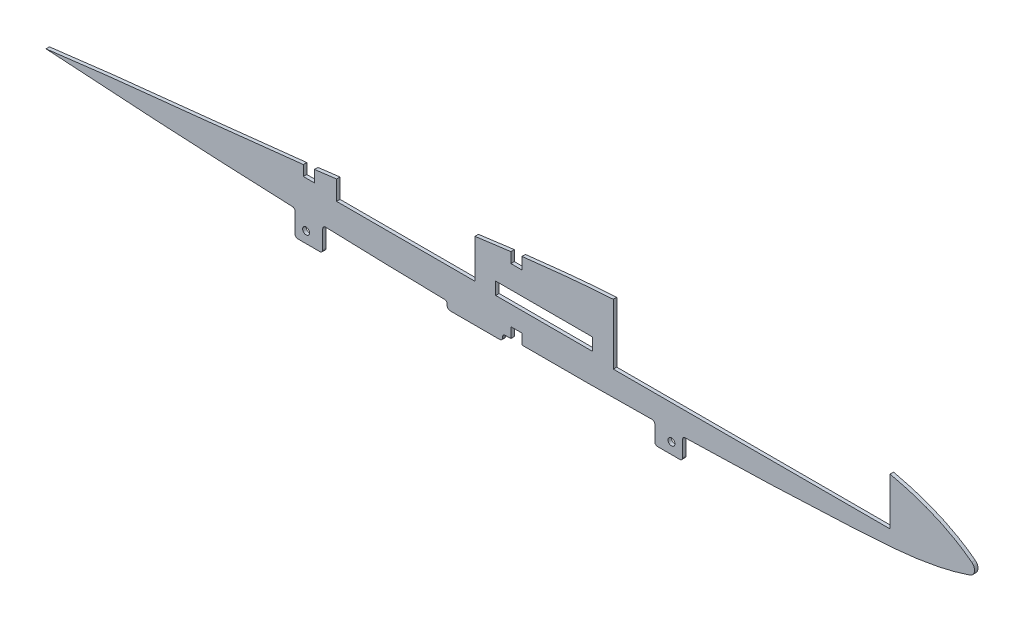
from build123d import *

# Parameters (mm, degrees)
BOSS_EXTRUDE1_DEPTH = 3.175
FILLET1_R           = 6.35
SKETCH6_W           = 88.9
SKETCH6_H           = 11.43
CUT_EXTRUDE3_DEPTH  = 5.08
SKETCH3_W           = 25.4
SKETCH3_H           = 3.175
BOSS_EXTRUDE2_DEPTH = 31.75
SKETCH3_3_W         = 50.8
SKETCH3_3_H         = 3.175
BOSS_EXTRUDE3_DEPTH = 19.05
FILLET2_R           = 2.54
CUT_EXTRUDE2_DEPTH  = 12.7
CUT_EXTRUDE4_DEPTH  = 5.08
SKETCH8_R           = 3.175
CUT_EXTRUDE5_DEPTH  = 504.378680986
CAVITY1_START       = 46.415619464
CAVITY1_OUTLINE_W   = 10.16
CAVITY1_OUTLINE_H   = 3.175
CAVITY1_DEPTH       = 10.772258138
CAVITY1_START_2     = 20.382459347
CAVITY1_2_OUTLINE_W = 10.16
CAVITY1_2_OUTLINE_H = 3.175
CAVITY1_2_DEPTH     = 10.743999494
CAVITY1_START_3     = -13.279272859
CAVITY1_3_OUTLINE_W = 10.16
CAVITY1_3_OUTLINE_H = 3.175
CAVITY1_3_DEPTH     = 9.525


# Read off the part's stored shape, not the designer's step: Cavity1
with BuildPart() as part:
    # Sketch1 → Boss-Extrude1 (new body)
    with BuildSketch(Plane.XY):
        with BuildLine():
            add(Edge.make_bspline(
                [(-353.097115344, 3.76640622), (-263.60988857, 15.489732087), (-103.405625954, 27.702523148), (139.625383809, 69.731889132), (320.600909148, 70.897971745), (447.029350736, 49.156772515), (484.461992977, 32.39779841), (505.225432444, 13.29140622)],
                knots=[0, 0, 0, 0, 0.308401543, 0.542913332, 0.850169973, 0.887176211, 1, 1, 1, 1], degree=3))
            add(Edge.make_bspline(
                [(-353.097115344, 3.76640622), (-171.204173065, -8.622681299), (70.681231732, -17.726989966), (367.634485174, -8.589262826), (467.934967897, -1.634661846), (505.225432444, 13.29140622)],
                knots=[0, 0, 0, 0, 0.625313044, 0.861778666, 1, 1, 1, 1], degree=3))
        make_face()
    extrude(amount=BOSS_EXTRUDE1_DEPTH)

    # Fillet1
    fillet1_edges = [part.edges().sort_by_distance(p)[0] for p in [
        (505.225432444, 13.29140622, 1.5875),
    ]]
    fillet(fillet1_edges, radius=FILLET1_R)

    # Sketch6 → Cut-Extrude3 (cut)
    with BuildSketch(Plane.XY):
        with Locations((104.102884656, 19.812)):
            Rectangle(SKETCH6_W, SKETCH6_H)
    extrude(amount=CUT_EXTRUDE3_DEPTH, mode=Mode.SUBTRACT)

    # Sketch3 → Boss-Extrude2 (add)
    with BuildSketch(Plane(origin=(0, 0, 0), x_dir=(1, 0, 0), z_dir=(0, 1, 0))):
        with Locations((-111.797115344, -1.5875)):
            Rectangle(SKETCH3_W, SKETCH3_H)
        with Locations((218.402884656, -1.5875)):
            Rectangle(SKETCH3_W, SKETCH3_H)
    extrude(amount=-BOSS_EXTRUDE2_DEPTH)

    # Sketch3<3> → Boss-Extrude3 (add)
    with BuildSketch(Plane(origin=(0, 0, 0), x_dir=(1, 0, 0), z_dir=(0, 1, 0))):
        with Locations((40.53772502, -1.5875)):
            Rectangle(SKETCH3_3_W, SKETCH3_3_H)
    extrude(amount=-BOSS_EXTRUDE3_DEPTH)

    # Fillet2
    fillet2_edges = [part.edges().sort_by_distance(p)[0] for p in [
        (-124.497115344, -8.618440951, 1.5875),
        (-99.097115344, -9.553641032, 1.5875),
        (205.702884656, -12.629236372, 1.5875),
        (231.102884656, -12.164410009, 1.5875),
        (15.13772502, -12.521395898, 1.5875),
        (65.93772502, -13.158984983, 1.5875),
        (-124.497115344, -31.75, 1.5875),
        (-99.097115344, -31.75, 1.5875),
        (15.13772502, -19.05, 1.5875),
        (65.93772502, -19.05, 1.5875),
        (205.702884656, -31.75, 1.5875),
        (231.102884656, -31.75, 1.5875),
    ]]
    fillet(fillet2_edges, radius=FILLET2_R)

    # Sketch5 → Cut-Extrude2 (cut, symmetric)
    with BuildSketch(Plane.XY):
        with BuildLine():
            Line((167.602884656, 9.525), (421.602884656, 9.525))
            Line((421.602884656, 9.525), (421.602884656, 53.128136288))
            add(Edge.make_bspline(
                [(167.602884656, 65.051503813), (244.722722107, 70.03272949), (333.181087562, 68.488590043), (412.953469478, 55.01226242), (421.602884656, 53.128136288)],
                knots=[0.603089435, 0.603089435, 0.603089435, 0.603089435, 0.862957728, 0.895261032, 0.895261032, 0.895261032, 0.895261032], degree=3))
            Line((167.602884656, 65.051503813), (167.602884656, 9.525))
        make_face()
    extrude(amount=CUT_EXTRUDE2_DEPTH, both=True, mode=Mode.SUBTRACT)

    # Sketch7 → Cut-Extrude4 (cut)
    with BuildSketch(Plane.XY):
        with BuildLine():
            Line((40.602884656, 51.591569772), (40.602884656, 15.875))
            Line((40.602884656, 15.875), (-86.397115344, 15.875))
            Line((-86.397115344, 15.875), (-86.397115344, 33.671872302))
            add(Edge.make_bspline(
                [(-86.397115344, 33.671872302), (-85.336997309, 33.80875443), (-42.923565209, 39.312219047), (-0.873657075, 45.877823306), (40.602884656, 51.591569772)],
                knots=[0.304745552, 0.304745552, 0.304745552, 0.304745552, 0.308401543, 0.451045815, 0.451045815, 0.451045815, 0.451045815], degree=3))
        make_face()
    extrude(amount=CUT_EXTRUDE4_DEPTH, mode=Mode.SUBTRACT)

    # Sketch8 → Cut-Extrude5 (cut, through all)
    with BuildSketch(Plane.XY):
        with Locations((220.942884656, -21.59)):
            Circle(SKETCH8_R)
        with Locations((-114.337115344, -21.59)):
            Circle(SKETCH8_R)
    extrude(amount=CUT_EXTRUDE5_DEPTH, mode=Mode.SUBTRACT)

    # Cavity1 outline → Cavity1 (cut)
    with BuildSketch(Plane(origin=(0, 0, 0), x_dir=(1, 0, 0), z_dir=(0, 1, 0)).offset(CAVITY1_START)):
        with Locations((78.637724966, -1.5875)):
            Rectangle(CAVITY1_OUTLINE_W, CAVITY1_OUTLINE_H)
    extrude(amount=CAVITY1_DEPTH, mode=Mode.SUBTRACT)

    # Cavity1 2 outline → Cavity1 2 (cut)
    with BuildSketch(Plane(origin=(0, 0, 0), x_dir=(1, 0, 0), z_dir=(0, 1, 0)).offset(CAVITY1_START_2)):
        with Locations((-111.797115344, -1.5875)):
            Rectangle(CAVITY1_2_OUTLINE_W, CAVITY1_2_OUTLINE_H)
    extrude(amount=CAVITY1_2_DEPTH, mode=Mode.SUBTRACT)

    # Cavity1 3 outline → Cavity1 3 (cut)
    with BuildSketch(Plane(origin=(0, 0, 0), x_dir=(1, 0, 0), z_dir=(0, 1, 0)).offset(CAVITY1_START_3)):
        with Locations((78.637724966, -1.5875)):
            Rectangle(CAVITY1_3_OUTLINE_W, CAVITY1_3_OUTLINE_H)
    extrude(amount=CAVITY1_3_DEPTH, mode=Mode.SUBTRACT)


solid = part.part
